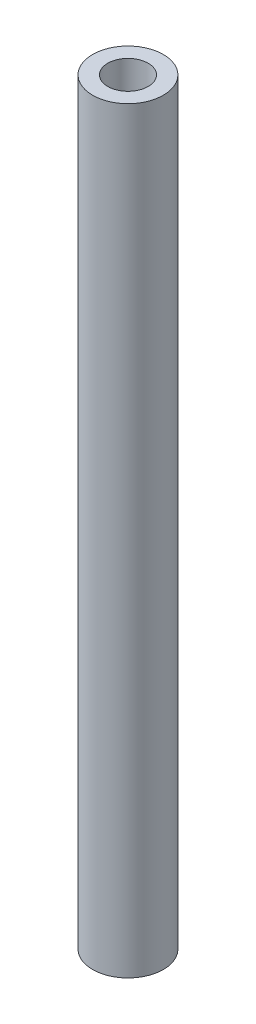
from build123d import *

# Parameters (mm, degrees)
SKETCH_1_R      = 7
SKETCH_1_R_2    = 4
EXTRUDE_1_DEPTH = 150


with BuildPart() as part:
    # 草图1 → 凸台-拉伸1 (new body)
    with BuildSketch(Plane(origin=(0, 0, 0), x_dir=(1, 0, 0), z_dir=(0, 1, 0))):
        Circle(SKETCH_1_R)
        Circle(SKETCH_1_R_2, mode=Mode.SUBTRACT)
    extrude(amount=EXTRUDE_1_DEPTH)


solid = part.part
